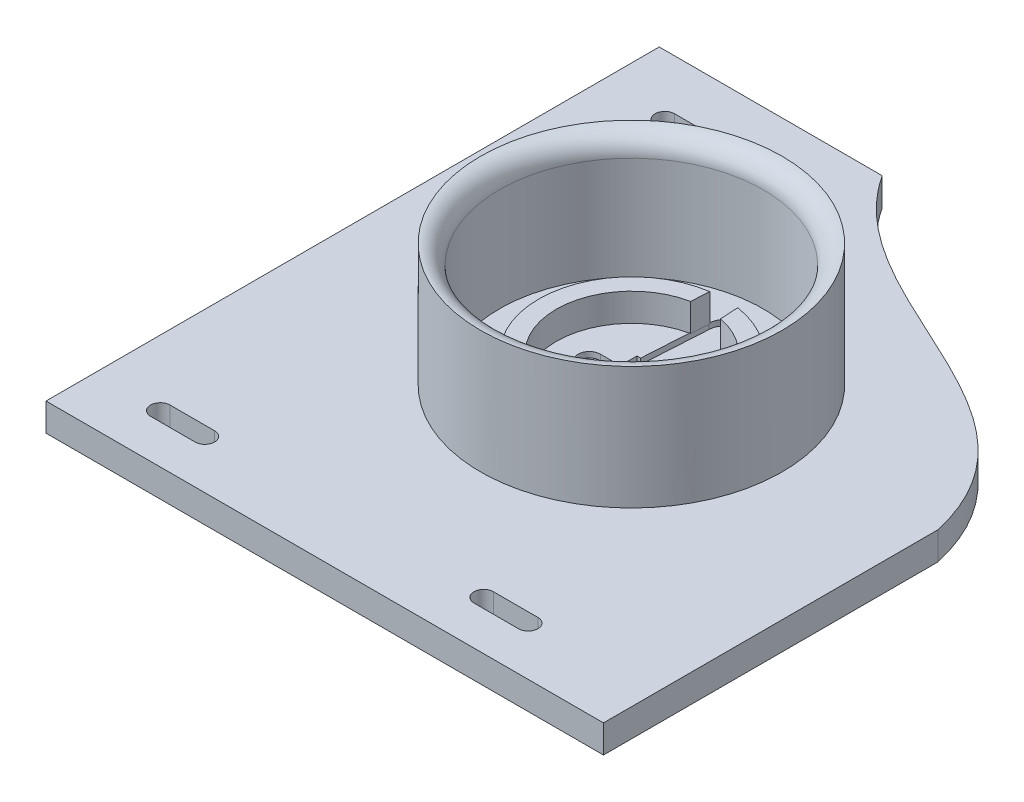
from build123d import *

# Parameters (mm, degrees)
BOSS_EXTRU_1_DEPTH      = 5
ENL_V_MAT_EXTRU_1_DEPTH = 15
ESQUISSE4_W             = 8
ESQUISSE4_H             = 10
ENL_V_MAT_EXTRU_2_DEPTH = 2.5
ENL_V_MAT_EXTRU_3_DEPTH = 1
ENL_V_MAT_EXTRU_4_DEPTH = 1
BOSS_EXTRU_2_DEPTH      = 5
ESQUISSE9_R             = 27.050324391
ESQUISSE9_R_2           = 23.650324391
BOSS_EXTRU_3_DEPTH      = 22
ESQUISSE10_R            = 3.42951926
ENL_V_MAT_EXTRU_5_DEPTH = 22


with BuildPart() as part:
    # Esquisse1 → Boss.-Extru.1 (new body)
    with BuildSketch(Plane(origin=(0, 0, 0), x_dir=(1, 0, 0), z_dir=(0, 1, 0))):
        with BuildLine():
            Line((-50, 55), (-10, 55))
            add(Edge.make_bspline(
                [(-10, 55), (5.148759318, 31.794007065), (43.163191576, 35.128217793), (50, 5)],
                knots=[0, 0, 0, 0, 1, 1, 1, 1], degree=3))
            Line((50, 5), (50, -55))
            Line((50, -55), (-50, -55))
            Line((-50, -55), (-50, 55))
        make_face()
    extrude(amount=BOSS_EXTRU_1_DEPTH)

    # Esquisse3 → Enlèv. mat.-Extru.1 (cut)
    with BuildSketch(Plane(origin=(0, 5, 0), x_dir=(1, 0, 0), z_dir=(0, 1, 0))):
        with BuildLine():
            Line((-38.25, 46), (-30.25, 46))
            ThreePointArc((-30.25, 46), (-28.5, 44.25), (-30.25, 42.5))
            Line((-30.25, 42.5), (-38.25, 42.5))
            ThreePointArc((-38.25, 42.5), (-40, 44.25), (-38.25, 46))
        make_face()
        with BuildLine():
            Line((-38.25, -44.5), (-30.25, -44.5))
            ThreePointArc((-30.25, -44.5), (-28.5, -46.25), (-30.25, -48))
            Line((-30.25, -48), (-38.25, -48))
            ThreePointArc((-38.25, -48), (-40, -46.25), (-38.25, -44.5))
        make_face()
        with BuildLine():
            Line((19.75, -44.5), (27.75, -44.5))
            ThreePointArc((27.75, -44.5), (29.5, -46.25), (27.75, -48))
            Line((27.75, -48), (19.75, -48))
            ThreePointArc((19.75, -48), (18, -46.25), (19.75, -44.5))
        make_face()
    extrude(amount=-ENL_V_MAT_EXTRU_1_DEPTH, mode=Mode.SUBTRACT)

    # Esquisse4 → Enlèv. mat.-Extru.2 (cut)
    with BuildSketch(Plane(origin=(0, 5, 0), x_dir=(1, 0, 0), z_dir=(0, 1, 0))):
        Rectangle(ESQUISSE4_W, ESQUISSE4_H)
    extrude(amount=-ENL_V_MAT_EXTRU_2_DEPTH, mode=Mode.SUBTRACT)

    # Esquisse6 → Enlèv. mat.-Extru.3 (cut)
    with BuildSketch(Plane(origin=(0, 5, 0), x_dir=(1, 0, 0), z_dir=(0, 1, 0))):
        with BuildLine():
            Line((-2.628313647, 16.593617601), (-3.628313647, 0.093617601))
            Line((-3.628313647, 0.093617601), (-2.628313647, -16.406382399))
            ThreePointArc((-2.628313647, -16.406382399), (-0.128313647, -18.906382399), (2.371686353, -16.406382399))
            Line((2.371686353, -16.406382399), (3.371686353, 0.093617601))
            Line((3.371686353, 0.093617601), (2.371686353, 16.593617601))
            ThreePointArc((2.371686353, 16.593617601), (-0.128313647, 19.093617601), (-2.628313647, 16.593617601))
        make_face()
    extrude(amount=-ENL_V_MAT_EXTRU_3_DEPTH, mode=Mode.SUBTRACT)

    # Esquisse7 → Enlèv. mat.-Extru.4 (cut)
    with BuildSketch(Plane(origin=(0, 5, 0), x_dir=(1, 0, 0), z_dir=(0, 1, 0))):
        with BuildLine():
            Line((-7.55, 2), (7.55, 2))
            ThreePointArc((7.55, 2), (9.55, 0), (7.55, -2))
            Line((7.55, -2), (-7.55, -2))
            ThreePointArc((-7.55, -2), (-9.55, 0), (-7.55, 2))
        make_face()
    extrude(amount=-ENL_V_MAT_EXTRU_4_DEPTH, mode=Mode.SUBTRACT)

    # Esquisse8 → Boss.-Extru.2 (add)
    with BuildSketch(Plane(origin=(0, 5, 0), x_dir=(1, 0, 0), z_dir=(0, 1, 0))):
        with BuildLine():
            Line((-2.462005123, 16.531813588), (-2.658382394, 13.291588605))
            ThreePointArc((-2.658382394, 13.291588605), (-13.493157472, 0.031813588), (-2.658382394, -13.22796143))
            Line((-2.658382394, -13.22796143), (-2.462005123, -16.468186412))
            ThreePointArc((-2.462005123, -16.468186412), (-16.650324391, 0.031813588), (-2.462005123, 16.531813588))
        make_face()
        with BuildLine():
            Line((2.537994877, 16.531813588), (2.734372149, 13.291588605))
            ThreePointArc((2.734372149, 13.291588605), (13.569147227, 0.031813588), (2.734372149, -13.22796143))
            Line((2.734372149, -13.22796143), (2.537994877, -16.468186412))
            ThreePointArc((2.537994877, -16.468186412), (16.726314146, 0.031813588), (2.537994877, 16.531813588))
        make_face()
    extrude(amount=BOSS_EXTRU_2_DEPTH)

    # Esquisse9 → Boss.-Extru.3 (add)
    with BuildSketch(Plane(origin=(0, 5, 0), x_dir=(1, 0, 0), z_dir=(0, 1, 0))):
        with Locations(Location((0, 0, 0), (0, 0, 90))):
            Circle(ESQUISSE9_R)
        with Locations(Location((0, 0, 0), (0, 0, 270))):
            Circle(ESQUISSE9_R_2, mode=Mode.SUBTRACT)
    extrude(amount=BOSS_EXTRU_3_DEPTH)

    # Esquisse10 → Enlèv. mat.-Extru.5 (cut)
    with BuildSketch(Plane(origin=(0, 2.5, 0), x_dir=(1, 0, 0), z_dir=(0, 1, 0))):
        with Locations(Location((0, 0, 0), (0, 0, 270))):
            Circle(ESQUISSE10_R)
    extrude(amount=-ENL_V_MAT_EXTRU_5_DEPTH, mode=Mode.SUBTRACT)

    # Congé1: read off the stored shape, not the designer's step
    # Congé1 outline → Congé1 (revolve, cut)
    with BuildSketch(Plane.XY):
        with BuildLine():
            ThreePointArc((23.650324391, 23.501428863), (24.640344311, 25.940691047), (27.050324391, 27))
            Line((27.050324391, 27), (23.650324391, 27))
            Line((23.650324391, 27), (23.650324391, 23.501428863))
        make_face()
    revolve(axis=Axis((0, 0, 0), (0, 1, 0)), mode=Mode.SUBTRACT)


solid = part.part
